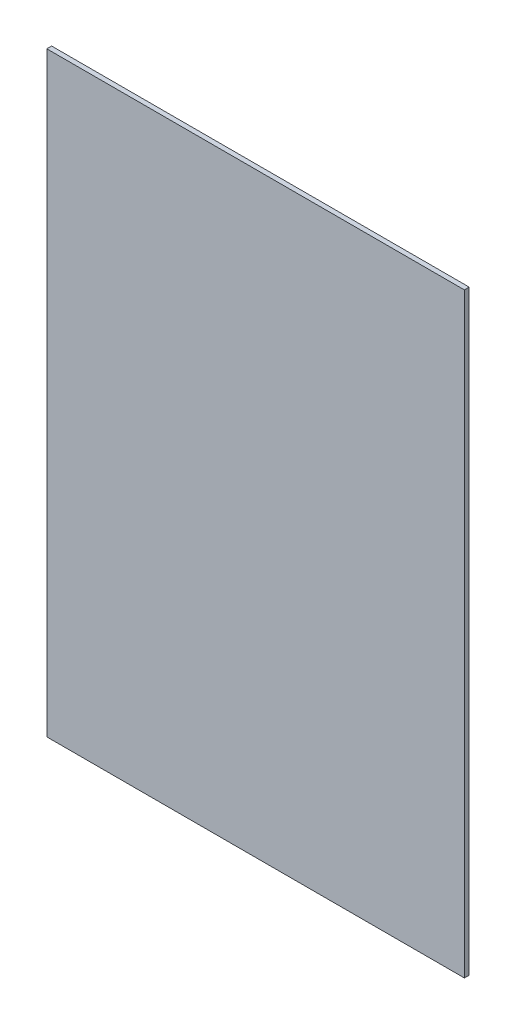
from build123d import *

# Parameters (mm, degrees)
SKETCH1_W           = 200
SKETCH1_H           = 285.39
BOSS_EXTRUDE1_DEPTH = 2.305


with BuildPart() as part:
    # Sketch1 → Boss-Extrude1 (new body)
    with BuildSketch(Plane.XY):
        Rectangle(SKETCH1_W, SKETCH1_H)
    extrude(amount=BOSS_EXTRUDE1_DEPTH)


solid = part.part
